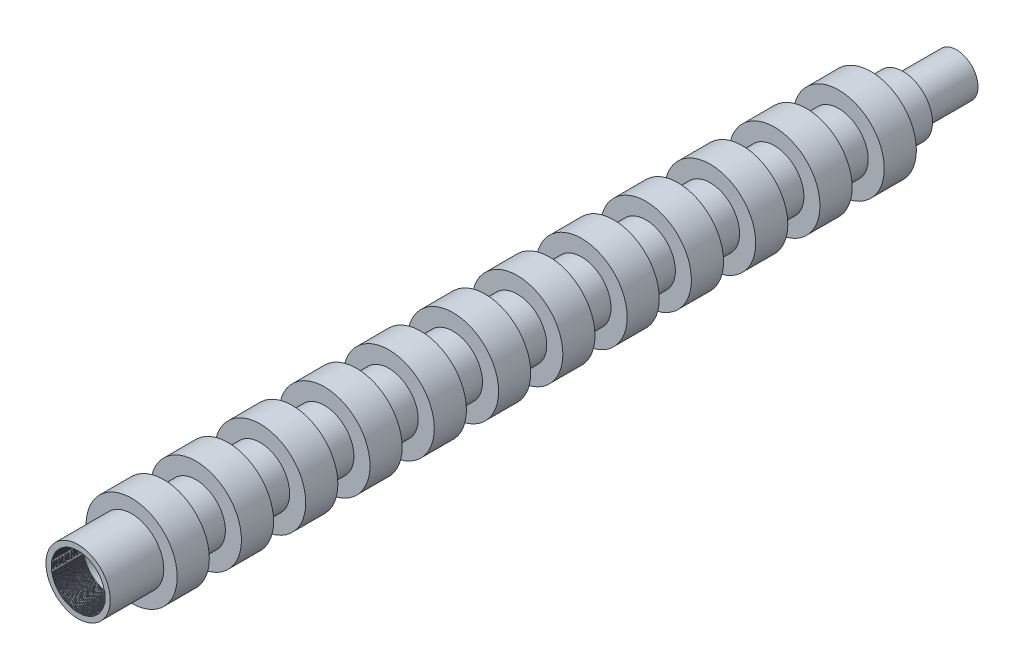
from build123d import *

# Parameters (mm, degrees)
SKETCH1_R           = 6
BOSS_EXTRUDE1_DEPTH = 10
SKETCH1_3_R         = 8.5
BOSS_EXTRUDE2_DEPTH = 144
SKETCH4_W           = 6
SKETCH4_H           = 6
LPATTERN1_COUNT     = 12
LPATTERN1_PITCH     = 12
SKETCH7_R           = 5
SKETCH7_W           = 10
SKETCH7_H           = 2
CUT_EXTRUDE1_DEPTH  = 10
CUT_SWEEP4_PITCH    = 0.225
SKETCH13_R          = 4
BOSS_EXTRUDE3_DEPTH = 10


with BuildPart() as part:
    # Sketch1 → Boss-Extrude1 (new body)
    with BuildSketch(Plane.XY):
        Circle(SKETCH1_R)
    extrude(amount=BOSS_EXTRUDE1_DEPTH)

    # Sketch7 → Cut-Extrude1 (cut)
    with BuildSketch(Plane.XY.offset(10)):
        Circle(SKETCH7_R)
        Rectangle(SKETCH7_W, SKETCH7_H)
    extrude(amount=-CUT_EXTRUDE1_DEPTH, mode=Mode.SUBTRACT)

    # Cut-Sweep4: arcs per turn and ends read off the stored shape
    # Cut-Sweep4: the profile of Sketch12 screwed along a right-hand helix through 26.666667 turns, 6 arcs to a turn; built about Z, then put on its axis
    cut_sweep4_z = Axis((0, 0, 0), (0, 0, 1))
    cut_sweep4_corners = [(5.000000206, 8.73e-07, 0.049999997), (4.950000206, 8.64e-07, -3e-09), (5.000000206, 8.73e-07, -0.050000003), (5.050000206, 8.81e-07, -3e-09)]
    with BuildLine(mode=Mode.PRIVATE) as cut_sweep4_profile:
        ThreePointArc((5.000000206, 8.73e-07, 0.049999997), (4.964644867, 8.66e-07, 0.035355336), (4.950000206, 8.64e-07, -3e-09))
        ThreePointArc((4.950000206, 8.64e-07, -3e-09), (4.964644867, 8.66e-07, -0.035355342), (5.000000206, 8.73e-07, -0.050000003))
        ThreePointArc((5.000000206, 8.73e-07, -0.050000003), (5.035355545, 8.79e-07, -0.035355342), (5.050000206, 8.81e-07, -3e-09))
        ThreePointArc((5.050000206, 8.81e-07, -3e-09), (5.035355545, 8.79e-07, 0.035355336), (5.000000206, 8.73e-07, 0.049999997))
    cut_sweep4_cap = Face(cut_sweep4_profile.wire())
    cut_sweep4_arcs = [((5.000000206, 8.73e-07, 0.049999997), (4.950000206, 8.64e-07, 0.049999997), (4.950000206, 8.64e-07, -3e-09), (1, 0.7071067811865476, 1)), ((4.950000206, 8.64e-07, -3e-09), (4.950000206, 8.64e-07, -0.050000003), (5.000000206, 8.73e-07, -0.050000003), (1, 0.7071067811865476, 1)), ((5.000000206, 8.73e-07, -0.050000003), (5.050000206, 8.81e-07, -0.050000003), (5.050000206, 8.81e-07, -3e-09), (1, 0.7071067811865476, 1)), ((5.050000206, 8.81e-07, -3e-09), (5.050000206, 8.81e-07, 0.049999997), (5.000000206, 8.73e-07, 0.049999997), (1, 0.7071067811865476, 1))]  # start, shoulder, end, weights
    cut_sweep4_turn_angles = [0, 30, 60, 90, 120, 150, 180, 210, 240, 270, 300, 330, 360]
    cut_sweep4_turn_weights = [1, 0.8660254037844387, 1, 0.8660254037844387, 1, 0.8660254037844387, 1, 0.8660254037844387, 1, 0.8660254037844387, 1, 0.8660254037844387, 1]
    cut_sweep4_turn_sides = [Face.make_bezier_surface([[Vector(p[j][0], p[j][1], 0).rotate(cut_sweep4_z, cut_sweep4_turn_angles[2 * i + k]) / cut_sweep4_turn_weights[2 * i + k] + Vector(0, 0, p[j][2] + CUT_SWEEP4_PITCH * cut_sweep4_turn_angles[2 * i + k] / 360) for k in range(3)] for j in range(3)], [[p[3][j] * cut_sweep4_turn_weights[2 * i + k] for k in range(3)] for j in range(3)]) for p in cut_sweep4_arcs for i in range(6)]
    cut_sweep4_last_angles = [9360, 9390, 9420, 9450, 9480, 9510, 9540, 9570, 9600]
    cut_sweep4_last_weights = [1, 0.8660254037844387, 1, 0.8660254037844387, 1, 0.8660254037844387, 1, 0.8660254037842641, 1]
    cut_sweep4_last_sides = [Face.make_bezier_surface([[Vector(p[j][0], p[j][1], 0).rotate(cut_sweep4_z, cut_sweep4_last_angles[2 * i + k]) / cut_sweep4_last_weights[2 * i + k] + Vector(0, 0, p[j][2] + CUT_SWEEP4_PITCH * cut_sweep4_last_angles[2 * i + k] / 360) for k in range(3)] for j in range(3)], [[p[3][j] * cut_sweep4_last_weights[2 * i + k] for k in range(3)] for j in range(3)]) for p in cut_sweep4_arcs for i in range(4)]
    cut_sweep4 = Plane(origin=(0, 0, 10), x_dir=(1, 0, 0), z_dir=(0, 0, -1)) * Solid(Shell([*[p.moved(Location((0, 0, CUT_SWEEP4_PITCH * i))) for i in range(26) for p in cut_sweep4_turn_sides], *cut_sweep4_last_sides, cut_sweep4_cap, cut_sweep4_cap.rotate(cut_sweep4_z, 9600).moved(Location((0, 0, CUT_SWEEP4_PITCH * 9600 / 360)))]))
    add(cut_sweep4, mode=Mode.SUBTRACT)


with BuildPart() as body_2:
    # Sketch1<3> → Boss-Extrude2 (new body)
    with BuildSketch(Plane.XY):
        Circle(SKETCH1_3_R)
    extrude(amount=-BOSS_EXTRUDE2_DEPTH)

    # Cut-Sweep1: sweep along a path in Sketch3
    with BuildLine(Plane.XY) as cut_sweep1_path:
        CenterArc((0, 0), 8.5, 0, 360)
    # Sketch4 → Cut-Sweep1 (sweep, cut)
    with BuildSketch(Plane(origin=(0, 0, 0), x_dir=(0, 0, -1), z_dir=(1, 0, 0))):
        with Locations((9, 8.5)):
            Rectangle(SKETCH4_W, SKETCH4_H)
    cut_sweep1 = sweep(path=cut_sweep1_path.line, mode=Mode.SUBTRACT)

    # LPattern1: Cut-Sweep1 ×12
    with Locations(*[(0, 0, -i * LPATTERN1_PITCH) for i in range(1, LPATTERN1_COUNT)]):
        add(cut_sweep1, mode=Mode.SUBTRACT)

    # Sketch13 → Boss-Extrude3 (add)
    with BuildSketch(Plane(origin=(0, 0, -144), x_dir=(-1, 0, 0), z_dir=(0, 0, -1))):
        with Locations(Location((0, 0, 0), (0, 0, 180))):
            Circle(SKETCH13_R)
    extrude(amount=BOSS_EXTRUDE3_DEPTH)


solid = Compound([part.part, body_2.part])
